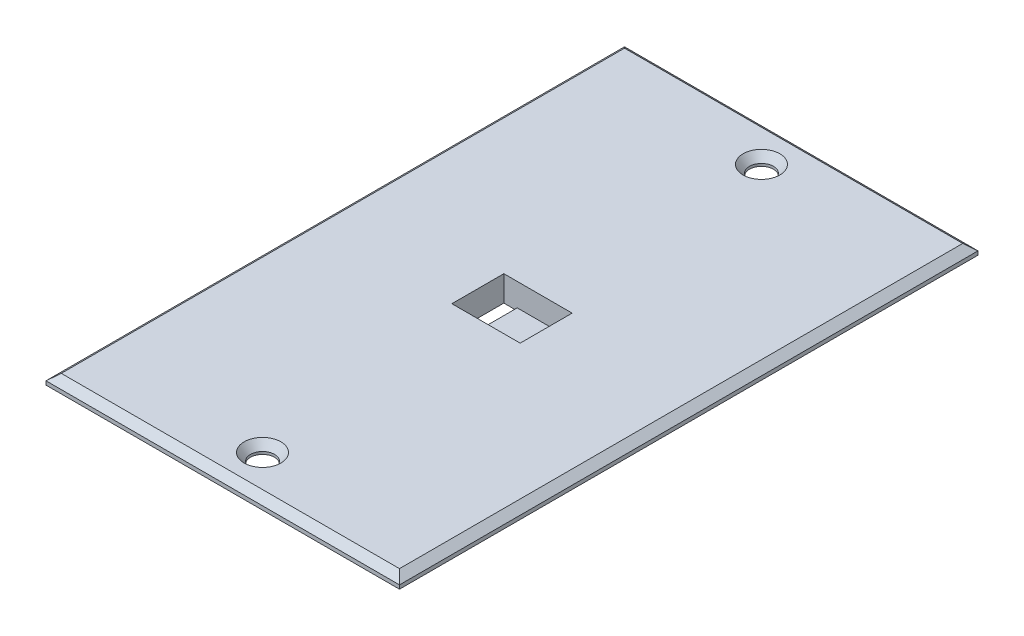
from build123d import *
from OCP.BRepFilletAPI import BRepFilletAPI_MakeChamfer

# Parameters (mm, degrees)
SKETCH1_W            = 69.35
SKETCH1_H            = 113.5
BOSS_EXTRUDE5_DEPTH  = 2
SKETCH2_R            = 2.35
CUT_EXTRUDE3_DEPTH   = 2.5
FACE_CHAMFER_SIZE    = 1.5
FACE_CHAMFER_SIZE2   = 1.258649447
SKETCH4_W            = 60.238416088
SKETCH4_H            = 90.514495008
CUT_EXTRUDE6_DEPTH   = 1.5
SKETCH5_W            = 20.93325514
SKETCH5_H            = 17.0989254
SKETCH5_W_2          = 13.4
SKETCH5_H_2          = 10.2
BOSS_EXTRUDE7_DEPTH  = 4.5
SKETCH6_W            = 13.4
SKETCH6_H            = 10.2
CUT_EXTRUDE7_DEPTH   = 4.1
SKETCH7_W            = 20.93325514
SKETCH7_H            = 17.0989254
BOSS_EXTRUDE8_DEPTH  = 0.5
SKETCH8_W            = 2.621357244
SKETCH8_H            = 10.2
CUT_EXTRUDE8_DEPTH   = 0.5
SKETCH10_W           = 1.18316995
SKETCH10_H           = 0.660821766
BOSS_EXTRUDE11_DEPTH = 1
FILLET1_R            = 0.9


with BuildPart() as part:
    # Sketch1 → Boss-Extrude5 (new body)
    with BuildSketch(Plane(origin=(0, 0, 0), x_dir=(1, 0, 0), z_dir=(0, 1, 0))):
        Rectangle(SKETCH1_W, SKETCH1_H)
    extrude(amount=BOSS_EXTRUDE5_DEPTH)

    # Sketch2 → Cut-Extrude3 (cut)
    with BuildSketch(Plane(origin=(0, 2, 0), x_dir=(1, 0, 0), z_dir=(0, 1, 0))):
        with Locations(Location((0, 48.943079059, 0), (0, 0, 270))):
            Circle(SKETCH2_R)
        with Locations(Location((0, -48.943079059, 0), (0, 0, 90))):
            Circle(SKETCH2_R)
    extrude(amount=-CUT_EXTRUDE3_DEPTH, mode=Mode.SUBTRACT)

    # face chamfer: one chamfer whose edges measure the first distance from different faces: ONE call of the kernel's chamfer builder (chamfer() names one face for all edges)
    face_chamfer_edges_1 = [part.edges().sort_by_distance(p)[0] for p in [
        (0, 2, -56.75),
        (-34.675, 2, 0),
        (0, 2, 56.75),
        (34.675, 2, 0),
    ]]
    face_chamfer_side_1 = [part.faces().sort_by_distance(p)[0] for p in [
        (0, 2, 0),
    ]]
    face_chamfer_edges_2 = [part.edges().sort_by_distance(p)[0] for p in [
        (0, 2, -51.293079059),
    ]]
    face_chamfer_side_2 = [part.faces().sort_by_distance(p)[0] for p in [
        (0, 1, -51.293079059),
    ]]
    face_chamfer_edges_3 = [part.edges().sort_by_distance(p)[0] for p in [
        (0, 2, 51.293079059),
    ]]
    face_chamfer_side_3 = [part.faces().sort_by_distance(p)[0] for p in [
        (0, 1, 51.293079059),
    ]]
    face_chamfer = BRepFilletAPI_MakeChamfer(part.part.solid().wrapped)
    for e in face_chamfer_edges_1:
        face_chamfer.Add(FACE_CHAMFER_SIZE, FACE_CHAMFER_SIZE2, e.wrapped, face_chamfer_side_1[0].wrapped)  # the first distance lies on this face
    for e in face_chamfer_edges_2:
        face_chamfer.Add(FACE_CHAMFER_SIZE, FACE_CHAMFER_SIZE2, e.wrapped, face_chamfer_side_2[0].wrapped)  # the first distance lies on this face
    for e in face_chamfer_edges_3:
        face_chamfer.Add(FACE_CHAMFER_SIZE, FACE_CHAMFER_SIZE2, e.wrapped, face_chamfer_side_3[0].wrapped)  # the first distance lies on this face
    add(Compound.cast(face_chamfer.Shape()), mode=Mode.REPLACE)

    # Sketch4 → Cut-Extrude6 (cut)
    with BuildSketch(Plane(origin=(0, 0, 0), x_dir=(-1, 0, 0), z_dir=(0, -1, 0))):
        Rectangle(SKETCH4_W, SKETCH4_H)
    extrude(amount=-CUT_EXTRUDE6_DEPTH, mode=Mode.SUBTRACT)

    # Sketch5 → Boss-Extrude7 (add)
    with BuildSketch(Plane(origin=(0, 2, 0), x_dir=(1, 0, 0), z_dir=(0, 1, 0))):
        Rectangle(SKETCH5_W, SKETCH5_H)
        Rectangle(SKETCH5_W_2, SKETCH5_H_2, mode=Mode.SUBTRACT)
    extrude(amount=-BOSS_EXTRUDE7_DEPTH)

    # Sketch6 → Cut-Extrude7 (cut)
    with BuildSketch(Plane(origin=(0, 2, 0), x_dir=(1, 0, 0), z_dir=(0, 1, 0))):
        Rectangle(SKETCH6_W, SKETCH6_H)
    extrude(amount=-CUT_EXTRUDE7_DEPTH, mode=Mode.SUBTRACT)

    # Sketch7 → Boss-Extrude8 (add)
    with BuildSketch(Plane.XZ.offset(2.5)):
        Rectangle(SKETCH7_W, SKETCH7_H)
    extrude(amount=BOSS_EXTRUDE8_DEPTH)

    # Sketch8 → Cut-Extrude8 (cut)
    with BuildSketch(Plane(origin=(0, -2.5, 0), x_dir=(1, 0, 0), z_dir=(0, 1, 0))):
        with Locations((-5.389321378, 0)):
            Rectangle(SKETCH8_W, SKETCH8_H)
    extrude(amount=-CUT_EXTRUDE8_DEPTH, mode=Mode.SUBTRACT)

    # Sketch10 → Boss-Extrude11 (add)
    with BuildSketch(Plane.ZY.offset(-6.7)):
        with Locations((-0.045919003, 0.630410883)):
            Rectangle(SKETCH10_W, SKETCH10_H)
    extrude(amount=BOSS_EXTRUDE11_DEPTH)

    # Fillet1
    # the kernel refuses this fillet: 0.9 mm, written as the material it takes off along each edge
    with BuildSketch(Plane(origin=(5.7, 0.960821766, 2.714758197), x_dir=(1, 0, 0), z_dir=(0, 0, -1))) as fillet1_piece_1:
        with BuildLine():
            CenterArc((0.86763689, 0.9), FILLET1_R, 195.411736224, 74.588263776)
            Line((0, 0.660821766), (-0.017352738, 0.656038202))
            ThreePointArc((-0.017352738, 0.656038202), (-0.018, 0.330410883), (-0.018, 0))
            Line((-0.018, 0), (0, -0.018))
            Line((0, -0.018), (0.86763689, -0.018))
            Line((0.86763689, -0.018), (0.86763689, 0))
        make_face()
    extrude(amount=5.521354399, mode=Mode.SUBTRACT)


solid = part.part
